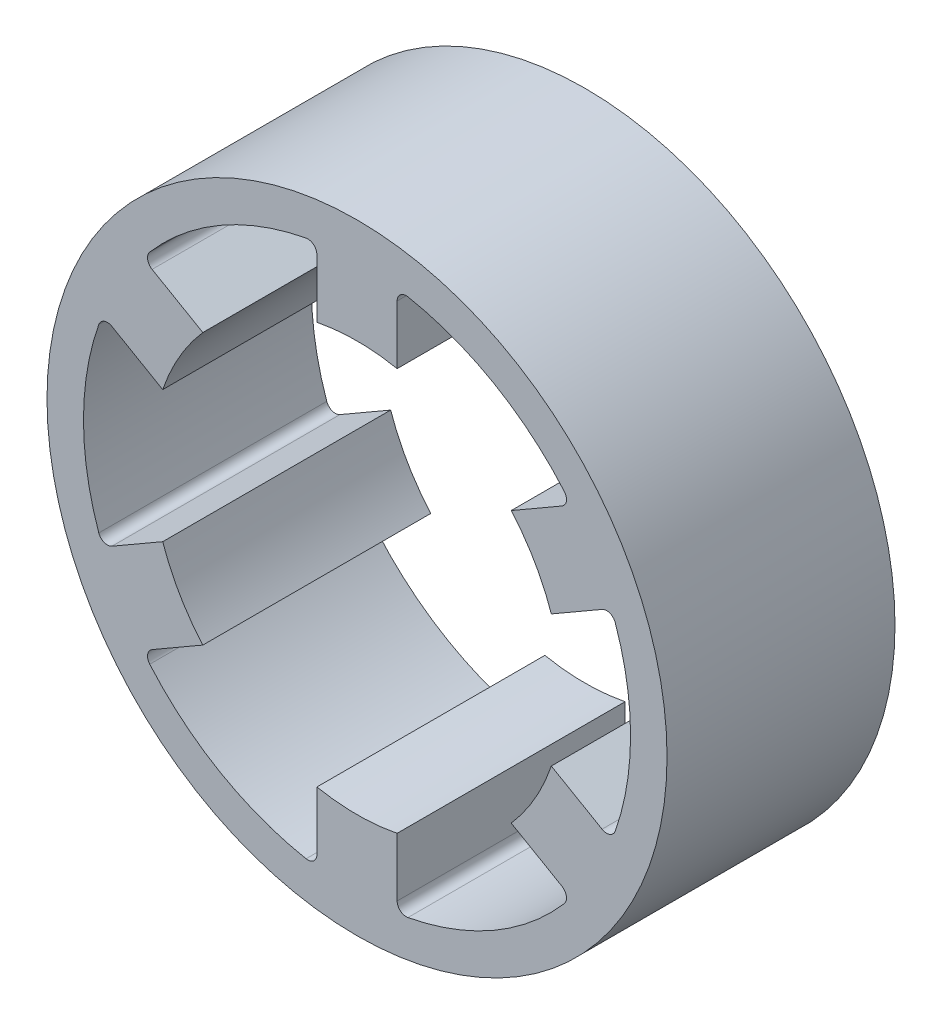
from build123d import *

# Parameters (mm, degrees)
SKETCH_1_W                       = 50
SKETCH_1_H                       = 23
CUT_EXTRUDE_1_DEPTH              = 109.388191239
FILLET_1_R                       = 2
PATTERN_CIRCULAR_1_COUNT         = 6
FILLET_1_OF_PATTERN_CIRCULAR_1_R = 2


with BuildPart() as part:
    # Эскиз1 → Повернуть1 (revolve)
    with BuildSketch(Plane(origin=(0, 0, 0), x_dir=(0, 0, -1), z_dir=(1, 0, 0))):
        with Locations((25, 56.5)):
            Rectangle(SKETCH_1_W, SKETCH_1_H)
    revolve(axis=Axis((0, 0, 0), (0, 0, -1)))

    # Эскиз2 → Вырез-Вытянуть1 (cut, through all)
    with BuildSketch(Plane.XY):
        with BuildLine():
            Line((-8.8, 59.351158371), (-8.8, 44.131168124))
            ThreePointArc((-8.8, 44.131168124), (-15.861240947, 42.112005837), (-22.5, 38.97114317))
            Line((-22.5, 38.97114317), (-30, 51.961524227))
            ThreePointArc((-30, 51.961524227), (-19.748713204, 56.65675888), (-8.8, 59.351158371))
        make_face()
        with BuildLine():
            Line((8.8, 59.351158371), (8.8, 44.131168124))
            ThreePointArc((8.8, 44.131168124), (15.861240947, 42.112005837), (22.5, 38.97114317))
            Line((22.5, 38.97114317), (30, 51.961524227))
            ThreePointArc((30, 51.961524227), (19.748713204, 56.65675888), (8.8, 59.351158371))
        make_face()
    cut_extrude_1 = extrude(amount=-CUT_EXTRUDE_1_DEPTH, mode=Mode.SUBTRACT)

    # Скругление1
    fillet_1_edges = [part.edges().sort_by_distance(p)[0] for p in [
        (8.8, 59.351158371, -25),
        (-8.8, 59.351158371, -25),
    ]]
    fillet(fillet_1_edges, radius=FILLET_1_R)

    # Круговой массив1: Вырез-Вытянуть1 ×6 about axis
    pattern_circular_1_axis = Axis((0, 0, 0), (0, 0, 1))
    for i in range(1, PATTERN_CIRCULAR_1_COUNT):
        add(cut_extrude_1.rotate(pattern_circular_1_axis, i * 360 / PATTERN_CIRCULAR_1_COUNT), mode=Mode.SUBTRACT)

    # Скругление1 of Круговой массив1
    fillet_1_of_pattern_circular_1_edges = [part.edges().sort_by_distance(p)[0] for p in [
        (-46.999610893, 37.296602739, -25),
        (-55.799610893, 22.054555632, -25),
        (-55.799610893, -22.054555632, -25),
        (-46.999610893, -37.296602739, -25),
        (-8.8, -59.351158371, -25),
        (8.8, -59.351158371, -25),
        (46.999610893, -37.296602739, -25),
        (55.799610893, -22.054555632, -25),
        (55.799610893, 22.054555632, -25),
        (46.999610893, 37.296602739, -25),
    ]]
    fillet(fillet_1_of_pattern_circular_1_edges, radius=FILLET_1_OF_PATTERN_CIRCULAR_1_R)


solid = part.part
